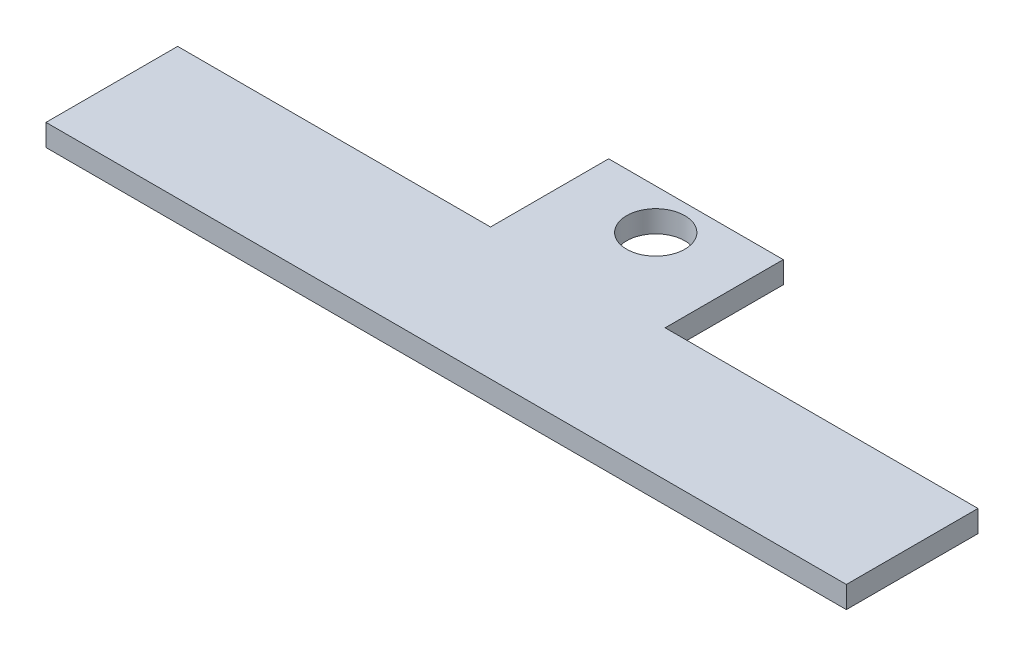
from build123d import *

# Parameters (mm, degrees)
SKETCH_1_R      = 2
EXTRUDE_1_DEPTH = 1.5


with BuildPart() as part:
    # Эскиз1 → Бобышка-Вытянуть1 (new body)
    with BuildSketch(Plane(origin=(0, 0, 0), x_dir=(1, 0, 0), z_dir=(0, 1, 0))):
        Polygon((0, 9.046468405), (21.5, 9.046468405), (21.5, 17.164912407), (33.5, 17.164912407), (33.5, 9.046468405), (55, 9.046468405), (55, 0), (0, 0), align=None)
        with Locations((27.5, 14.4)):
            Circle(SKETCH_1_R, mode=Mode.SUBTRACT)
    extrude(amount=EXTRUDE_1_DEPTH)


solid = part.part
